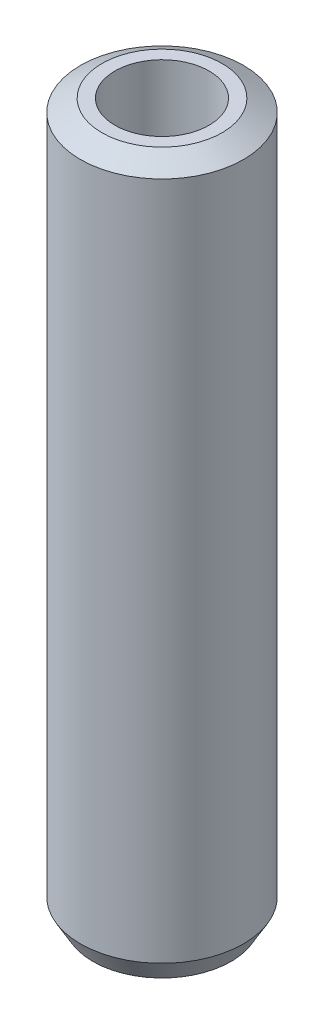
from build123d import *
from OCP.BRepFilletAPI import BRepFilletAPI_MakeChamfer

# Parameters (mm, degrees)
SKETCH1_R           = 30
BOSS_EXTRUDE1_DEPTH = 262.363190982
SKETCH2_R           = 17.319461493
CUT_EXTRUDE1_DEPTH  = 266.771413027
CHAMFER1_SIZE       = 4.566750464
CHAMFER1_SIZE2      = 7.909843828


with BuildPart() as part:
    # Sketch1 → Boss-Extrude1 (new body)
    with BuildSketch(Plane(origin=(0, 0, 0), x_dir=(1, 0, 0), z_dir=(0, 1, 0))):
        Circle(SKETCH1_R)
    extrude(amount=BOSS_EXTRUDE1_DEPTH)

    # Sketch2 → Cut-Extrude1 (cut, through all)
    with BuildSketch(Plane(origin=(0, 0, 0), x_dir=(1, 0, 0), z_dir=(0, 1, 0))):
        Circle(SKETCH2_R)
    extrude(amount=CUT_EXTRUDE1_DEPTH, mode=Mode.SUBTRACT)

    # Chamfer1: one chamfer whose edges measure the first distance from different faces: ONE call of the kernel's chamfer builder (chamfer() names one face for all edges)
    chamfer1_edges_1 = [part.edges().sort_by_distance(p)[0] for p in [
        (-30, 262.363190982, 0),
    ]]
    chamfer1_side_1 = [part.faces().sort_by_distance(p)[0] for p in [
        (-30, 131.181595491, 0),
    ]]
    chamfer1_edges_2 = [part.edges().sort_by_distance(p)[0] for p in [
        (-30, 0, 0),
    ]]
    chamfer1_side_2 = [part.faces().sort_by_distance(p)[0] for p in [
        (-29.151471863, 0, 0),
    ]]
    chamfer1 = BRepFilletAPI_MakeChamfer(part.part.solid().wrapped)
    for e in chamfer1_edges_1:
        chamfer1.Add(CHAMFER1_SIZE, CHAMFER1_SIZE2, e.wrapped, chamfer1_side_1[0].wrapped)  # the first distance lies on this face
    for e in chamfer1_edges_2:
        chamfer1.Add(CHAMFER1_SIZE, CHAMFER1_SIZE2, e.wrapped, chamfer1_side_2[0].wrapped)  # the first distance lies on this face
    add(Compound.cast(chamfer1.Shape()), mode=Mode.REPLACE)


solid = part.part
